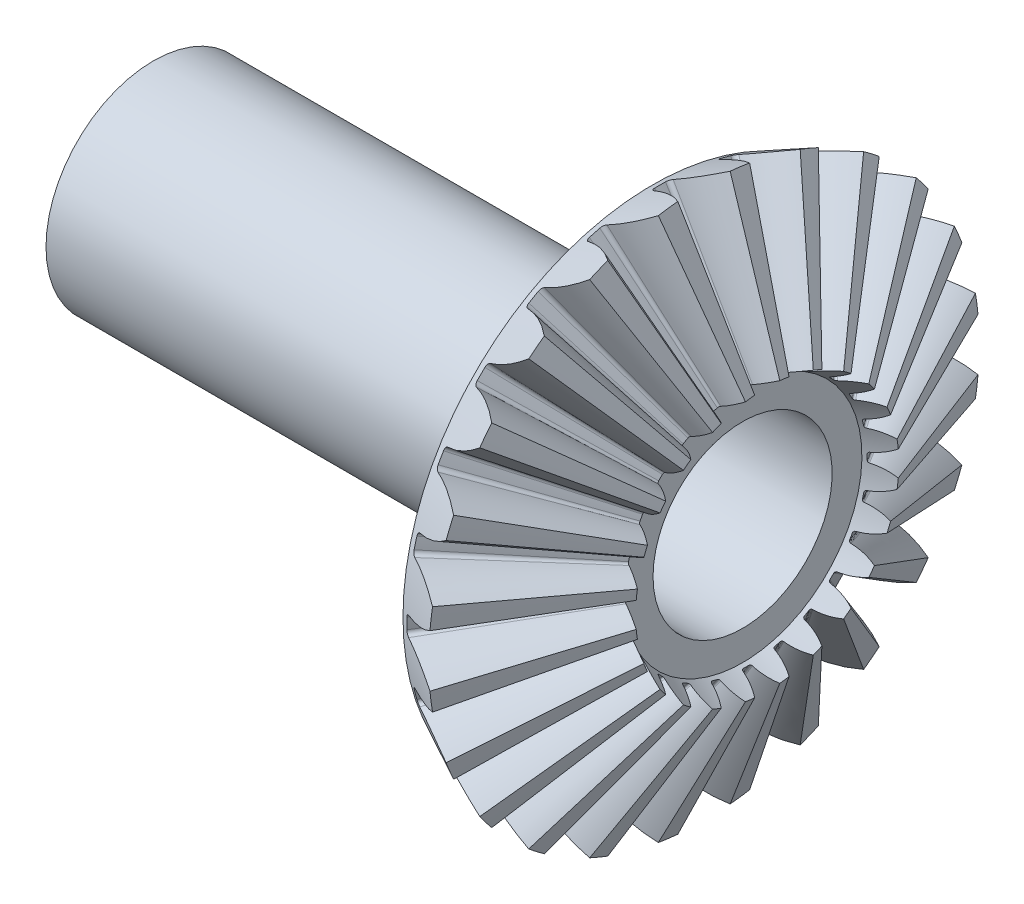
from build123d import *

# Parameters (mm, degrees)
TEETHCUTS_COUNT                      = 24
TEETHCUTS_ANGLE                      = 345
HUBSKE_R                             = 4.8
HUB_DEPTH                            = 22.285037461
BORSKE_R                             = 4
BORE_DEPTH                           = 30.0000508
BOSS_EXTRUDE1_REACH                  = 30.216
BOSS_EXTRUDE1_END_RADIUS             = 4
SKETCH1_R                            = 1.5
BOSS_EXTRUDE1_DIRECTION_2_REACH      = 30.216
BOSS_EXTRUDE1_DIRECTION_2_END_RADIUS = 4


with BuildPart() as part:
    # BasProSke → Base-Revolve (revolve)
    with BuildSketch(Plane(origin=(0, 0, 0), x_dir=(1, 0, 0), z_dir=(0, 1, 0)), mode=Mode.PRIVATE) as base_revolve_sk:
        Polygon((0, 0), (0, 11.142467933), (2.30091395, 12.292924904), (5.125742444, 5.87910123), (4.025328495, 5.328894258), (4.025328495, 0), align=None)
    revolve(base_revolve_sk.sketch.rotate(Axis((-10, 0, 0), (1, 0, 0)), 180), axis=Axis((-10, 0, 0), (1, 0, 0)))

    # ToothCut: read off the stored shape, not the designer's step
    # ToothCut: loft between two sections, ruled curve by curve
    toothcut_from = [
        Edge.make_bspline([(7.723651839, 0.004293849, -0.008312879), (7.718187749, 0.001561805, -0.015368804), (7.709864822, -0.002599659, -0.014649419), (7.705435657, -0.004814241, -0.00673838)], [0, 0, 0, 0, 1, 1, 1, 1], 3, [1, 0.729558285, 0.729558285, 1]),
        Edge.make_bspline([(7.705435657, -0.004814241, 0.00673838), (7.709864822, -0.002599659, 0.014649419), (7.718187749, 0.001561805, 0.015368804), (7.723651839, 0.004293849, 0.008312879)], [0, 0, 0, 0, 1, 1, 1, 1], 3, [1, 0.729558285, 0.729558285, 1]),
        Edge.make_bspline([(7.705435657, -0.004814241, -0.00673838), (7.704861752, -0.005101194, -0.005713314), (7.704423725, -0.005320207, -0.004607585), (7.704130438, -0.005466851, -0.003443562)], [0, 0, 0, 0, 1, 1, 1, 1], 3, [1, 0.9932568, 0.9932568, 1]),
        Edge.make_bspline([(7.704130438, -0.005466851, 0.003443562), (7.704423725, -0.005320207, 0.004607585), (7.704861752, -0.005101194, 0.005713314), (7.705435657, -0.004814241, 0.00673838)], [0, 0, 0, 0, 1, 1, 1, 1], 3, [1, 0.9932568, 0.9932568, 1]),
        Edge.make_bspline([(7.704130438, -0.005466851, -0.003443562), (7.70355942, -0.00575236, -0.001177256), (7.70355942, -0.00575236, 0.001177256), (7.704130438, -0.005466851, 0.003443562)], [0, 0, 0, 0, 1, 1, 1, 1], 3, [1, 0.975025372, 0.975025372, 1]),
        Edge.make_line((7.723651839, 0.004293849, 0.008312879), (7.723651839, 0.004293849, -0.008312879)),
    ]
    toothcut_to = [
        Edge.make_bspline([(2.467042523, 12.375989191, -1.317007542), (1.881121431, 12.083028645, -0.838483932), (1.207297185, 11.746116524, -0.537543138), (0.487747509, 11.386341686, -0.433022409)], [0, 0, 0, 0, 1, 1, 1, 1], 3, [1, 0.979135152, 0.979135152, 1]),
        Edge.make_bspline([(0.487747509, 11.386341686, 0.433022409), (1.207297185, 11.746116524, 0.537543138), (1.881121431, 12.083028645, 0.838483932), (2.467042523, 12.375989191, 1.317007542)], [0, 0, 0, 0, 1, 1, 1, 1], 3, [1, 0.979135152, 0.979135152, 1]),
        Edge.make_bspline([(0.487747509, 11.386341686, -0.433022409), (0.397621574, 11.341278719, -0.419930849), (0.338430856, 11.31168336, -0.342824961), (0.340525718, 11.312730791, -0.241241209)], [0, 0, 0, 0, 1, 1, 1, 1], 3, [1, 0.829081524, 0.829081524, 1]),
        Edge.make_bspline([(0.340525718, 11.312730791, 0.241241209), (0.338430856, 11.31168336, 0.342824961), (0.397621574, 11.341278719, 0.419930849), (0.487747509, 11.386341686, 0.433022409)], [0, 0, 0, 0, 1, 1, 1, 1], 3, [1, 0.829081524, 0.829081524, 1]),
        Edge.make_bspline([(0.340525718, 11.312730791, -0.241241209), (0.343842011, 11.314388938, -0.080427982), (0.343842011, 11.314388938, 0.080427982), (0.340525718, 11.312730791, 0.241241209)], [0, 0, 0, 0, 1, 1, 1, 1], 3, [1, 0.999822876, 0.999822876, 1]),
        Edge.make_line((2.467042523, 12.375989191, 1.317007542), (2.467042523, 12.375989191, -1.317007542)),
    ]
    toothcut = Solid(Shell([*[Face.make_surface_from_curves(toothcut_from[k], toothcut_to[k]) for k in range(6)], Face(Wire(toothcut_from)), Face(Wire(toothcut_to))]))
    add(toothcut, mode=Mode.SUBTRACT)

    # TeethCuts: ToothCut ×24 about axis
    teethcuts_axis = Axis((-10, 0, 0), (1, 0, 0))
    for i in range(1, TEETHCUTS_COUNT):
        add(toothcut.rotate(teethcuts_axis, i * TEETHCUTS_ANGLE / (TEETHCUTS_COUNT - 1)), mode=Mode.SUBTRACT)

    # HubSke → Hub (add)
    with BuildSketch(Plane.ZY):
        with Locations(Location((0, 0, 0), (0, 0, 180))):
            Circle(HUBSKE_R)
    extrude(amount=HUB_DEPTH)

    # BorSke → Bore (cut, symmetric)
    with BuildSketch(Plane(origin=(0, 0, 0), x_dir=(0, 0, -1), z_dir=(1, 0, 0))):
        with Locations(Location((0, 0, 0), (0, 0, 180))):
            Circle(BORSKE_R)
    extrude(amount=BORE_DEPTH, both=True, mode=Mode.SUBTRACT)

    # Boss-Extrude1: up to this cylinder (the profile starts inside it)
    boss_extrude1_end = Plane(origin=(-15, 0, 0), z_dir=(-1, 0, 0)) * Cylinder(BOSS_EXTRUDE1_END_RADIUS, 69.432, mode=Mode.PRIVATE)
    # Sketch1 → Boss-Extrude1 (add, up to the surface)
    with BuildSketch(Plane(origin=(0, 0, 0), x_dir=(1, 0, 0), z_dir=(0, 1, 0)), mode=Mode.PRIVATE) as boss_extrude1_sk1:
        with Locations(Location((-15, 0, 0), (0, 0, 270))):
            Circle(SKETCH1_R)
    boss_extrude1_tool1 = extrude(boss_extrude1_sk1.sketch, amount=BOSS_EXTRUDE1_REACH, mode=Mode.PRIVATE) & boss_extrude1_end
    add(boss_extrude1_tool1.solids().sort_by_distance((-15, 0, 0))[0])

    # Boss-Extrude1 direction 2: up to this cylinder (the profile starts inside it)
    boss_extrude1_direction_2_end = Plane(origin=(-15, 0, 0), z_dir=(-1, 0, 0)) * Cylinder(BOSS_EXTRUDE1_DIRECTION_2_END_RADIUS, 69.432, mode=Mode.PRIVATE)
    # Sketch1 → Boss-Extrude1 direction 2 (add, up to the surface)
    with BuildSketch(Plane(origin=(0, 0, 0), x_dir=(1, 0, 0), z_dir=(0, 1, 0)), mode=Mode.PRIVATE) as boss_extrude1_direction_2_sk1:
        with Locations(Location((-15, 0, 0), (0, 0, 270))):
            Circle(SKETCH1_R)
    boss_extrude1_direction_2_tool1 = extrude(boss_extrude1_direction_2_sk1.sketch, amount=-BOSS_EXTRUDE1_DIRECTION_2_REACH, mode=Mode.PRIVATE) & boss_extrude1_direction_2_end
    add(boss_extrude1_direction_2_tool1.solids().sort_by_distance((-15, 0, 0))[0])


solid = part.part
